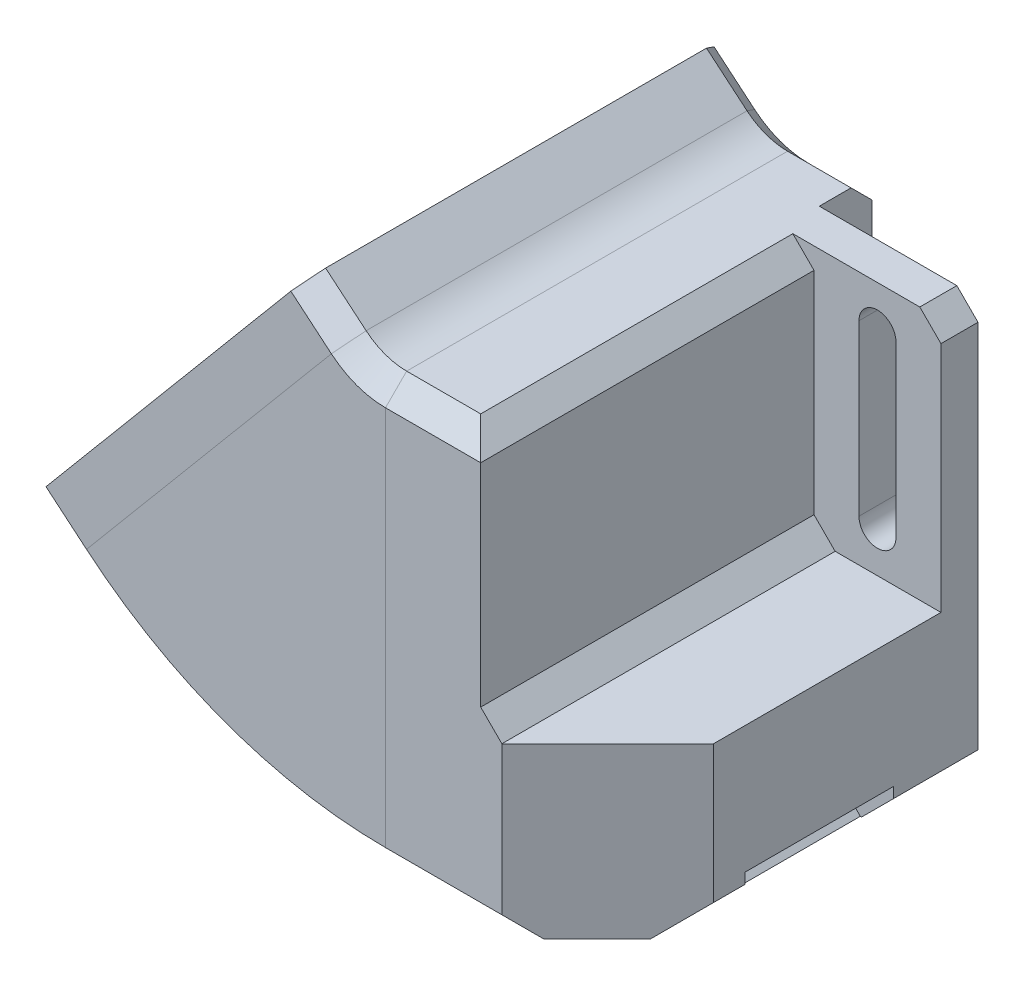
from build123d import *

# Parameters (mm, degrees)
SKETCH3_W                = 40
SKETCH3_H                = 40
SKETCH3_W_2              = 34
SKETCH3_H_2              = 34
BOSS_EXTRUDE2_REACH      = 64.147
SKETCH7_W                = 16
SKETCH7_H                = 28
BOSS_EXTRUDE5_DEPTH      = 1
BOSS_EXTRUDE5_DEPTH_BACK = 5
SKETCH8_W                = 13
SKETCH8_H                = 40
CHAMFER1_SIZE            = 6
CHAMFER2_SIZE            = 4
SKETCH9_W                = 14
SKETCH9_H                = 3
CUT_EXTRUDE1_DEPTH       = 16
SKETCH10_W               = 12
SKETCH10_H               = 24
CUT_EXTRUDE2_DEPTH       = 72.149717806
SKETCH11_W               = 15
SKETCH11_H               = 40
BOSS_EXTRUDE6_DEPTH      = 7
CUT_EXTRUDE3_DEPTH       = 66.163504693
CUT_EXTRUDE4_REACH       = 60.927
SKETCH13_W               = 12
SKETCH13_H               = 3.5
SKETCH15_W               = 4.5
SKETCH15_H               = 4.5
BOSS_EXTRUDE7_DEPTH      = 5
SKETCH14_R               = 1.5
CUT_EXTRUDE5_DEPTH       = 8
CHAMFER3_SIZE            = 14
CHAMFER7_SIZE            = 3
CHAMFER4_SIZE            = 14
CHAMFER5_SIZE            = 2
CHAMFER9_SIZE            = 2
CHAMFER10_SIZE           = 2.121320344
CHAMFER10_SIZE_2         = 1.5
CHAMFER11_SIZE           = 10
CHAMFER12_SIZE           = 2


# Some blends are built 0.0001 mm under size
with BuildPart() as part:
    # Sweep1: sweep along a path in Sketch2
    with BuildLine(Plane.XY) as sweep1_path:
        Line((0, 0), (-5, 0))
        ThreePointArc((-5, 0), (-20.718824406, 2.771652848), (-34.541726603, 10.752309152))
        Line((-34.541726603, 10.752309152), (-38.371948819, 13.966247201))
    # Sketch3 → Sweep1 (sweep)
    with BuildSketch(Plane(origin=(0, 0, 0), x_dir=(0, 0, -1), z_dir=(1, 0, 0))):
        with Locations((0, 20)):
            Rectangle(SKETCH3_W, SKETCH3_H)
        with Locations((0, 20)):
            Rectangle(SKETCH3_W_2, SKETCH3_H_2, mode=Mode.SUBTRACT)
    sweep(path=sweep1_path.line)

    # Boss-Extrude2: up to this face of the body (flat: up to its plane)
    boss_extrude2_end = Plane(part.part.faces().sort_by_distance((-2.5, 40, 0))[0])
    # Sketch7 → Boss-Extrude2 (add, up to the picked face)
    with BuildSketch(Plane(origin=(0, 0, 0), x_dir=(1, 0, 0), z_dir=(0, 1, 0)), mode=Mode.PRIVATE) as boss_extrude2_sk1:
        with Locations((8, -6)):
            Rectangle(SKETCH7_W, SKETCH7_H)
    boss_extrude2_tool1 = split(extrude(boss_extrude2_sk1.sketch, amount=BOSS_EXTRUDE2_REACH, mode=Mode.PRIVATE), bisect_by=boss_extrude2_end, keep=Keep.BOTH, mode=Mode.PRIVATE)
    add(boss_extrude2_tool1.solids().sort_by(Axis((8, 0, 6), (0, 1, 0)))[0])

    # Sketch8 → Boss-Extrude5 (add, two sides: drawn at the far end of the back side and taken through both)
    with BuildSketch(Plane(origin=(0, 0, 0), x_dir=(0, 0, -1), z_dir=(1, 0, 0)).offset(-BOSS_EXTRUDE5_DEPTH_BACK)):
        with Locations((13.5, 20)):
            Rectangle(SKETCH8_W, SKETCH8_H)
    extrude(amount=BOSS_EXTRUDE5_DEPTH + BOSS_EXTRUDE5_DEPTH_BACK)

    # Chamfer1
    chamfer1_edges = [part.edges().sort_by_distance(p)[0] for p in [
        (-5, 20, -17),
    ]]
    chamfer(chamfer1_edges, length=CHAMFER1_SIZE)

    # Chamfer2
    chamfer2_edges = [part.edges().sort_by_distance(p)[0] for p in [
        (-5, 20, -7),
    ]]
    chamfer(chamfer2_edges, length=CHAMFER2_SIZE - 0.0001)  # a hair under: the kernel refuses the full size

    # Sketch9 → Cut-Extrude1 (cut)
    with BuildSketch(Plane(origin=(16, 0, 0), x_dir=(0, 0, -1), z_dir=(1, 0, 0))):
        with Locations((0, 2.5)):
            Rectangle(SKETCH9_W, SKETCH9_H)
    extrude(amount=-CUT_EXTRUDE1_DEPTH, mode=Mode.SUBTRACT)

    # Sketch10 → Cut-Extrude2 (cut, through all)
    with BuildSketch(Plane.XY.offset(20)):
        with Locations((10, 28)):
            Rectangle(SKETCH10_W, SKETCH10_H)
    extrude(amount=-CUT_EXTRUDE2_DEPTH, mode=Mode.SUBTRACT)

    # Sketch11 → Boss-Extrude6 (add)
    with BuildSketch(Plane(origin=(0, 0, -8), x_dir=(-1, 0, 0), z_dir=(0, 0, -1))):
        with Locations((-8.5, 20)):
            Rectangle(SKETCH11_W, SKETCH11_H)
    extrude(amount=BOSS_EXTRUDE6_DEPTH)

    # Sketch12 → Cut-Extrude3 (cut, through all)
    with BuildSketch(Plane.XY.offset(-8)):
        with BuildLine():
            Line((11.75, 36), (11.75, 20))
            ThreePointArc((11.75, 20), (10, 18.25), (8.25, 20))
            Line((8.25, 20), (8.25, 36))
            ThreePointArc((8.25, 36), (10, 37.75), (11.75, 36))
        make_face()
    extrude(amount=-CUT_EXTRUDE3_DEPTH, mode=Mode.SUBTRACT)

    # Cut-Extrude4: up to this face of the body (flat: up to its plane)
    cut_extrude4_end = Plane(part.part.faces().sort_by_distance((10, 16, 6))[0])
    # Sketch13 → Cut-Extrude4 (cut, up to the picked face)
    with BuildSketch(Plane(origin=(0, 40, 0), x_dir=(1, 0, 0), z_dir=(0, 1, 0)), mode=Mode.PRIVATE) as cut_extrude4_sk1:
        with Locations((10, 9.75)):
            Rectangle(SKETCH13_W, SKETCH13_H)
    cut_extrude4_tool1 = split(extrude(cut_extrude4_sk1.sketch, amount=-CUT_EXTRUDE4_REACH, mode=Mode.PRIVATE), bisect_by=cut_extrude4_end, keep=Keep.BOTH, mode=Mode.PRIVATE)
    add(cut_extrude4_tool1.solids().sort_by(Axis((10, 40, -9.75), (0, -1, 0)))[0], mode=Mode.SUBTRACT)

    # Sketch15 → Boss-Extrude7 (add)
    with BuildSketch(Plane(origin=(-29.394618164, 24.66501326, 0), x_dir=(0, 0, 1), z_dir=(-0.7660444431189811, 0.6427876096865356, 0))):
        with Locations((-14.75, 20.783752799)):
            Rectangle(SKETCH15_W, SKETCH15_H)
        with Locations((14.75, 20.783752799)):
            Rectangle(SKETCH15_W, SKETCH15_H)
        with Locations((-14.75, -8.716247201)):
            Rectangle(SKETCH15_W, SKETCH15_H)
        with Locations((14.75, -8.716247201)):
            Rectangle(SKETCH15_W, SKETCH15_H)
    extrude(amount=-BOSS_EXTRUDE7_DEPTH)

    # Sketch14 → Cut-Extrude5 (cut)
    with BuildSketch(Plane(origin=(-29.394618164, 24.66501326, 0), x_dir=(0, 0, 1), z_dir=(-0.7660444431189811, 0.6427876096865356, 0))):
        with Locations(Location((-16, 22.033752799, 0), (0, 0, 270))):
            Circle(SKETCH14_R)
        with Locations(Location((16, 22.033752799, 0), (0, 0, 270))):
            Circle(SKETCH14_R)
        with Locations(Location((-16, -9.966247201, 0), (0, 0, 270))):
            Circle(SKETCH14_R)
        with Locations(Location((16, -9.966247201, 0), (0, 0, 270))):
            Circle(SKETCH14_R)
    extrude(amount=-CUT_EXTRUDE5_DEPTH, mode=Mode.SUBTRACT)

    # Chamfer3
    chamfer3_edges = [part.edges().sort_by_distance(p)[0] for p in [
        (0, 4, 0),
    ]]
    chamfer(chamfer3_edges, length=CHAMFER3_SIZE)

    # Chamfer7
    # the kernel refuses this chamfer: 3 mm, written as the material it takes off along each edge
    with BuildSketch(Plane(origin=(16, 0, 27.715048964), x_dir=(0.027495876610586778, 0.9996219169112968, 0), z_dir=(0, 0, -1))) as chamfer7_piece_1:
        Polygon((CHAMFER7_SIZE * 0.999621916911, -CHAMFER7_SIZE * 0.0274958766106), (-CHAMFER7_SIZE * 0.0274958766106, -CHAMFER7_SIZE * 0.999621916911), (0, 0), align=None)
    extrude(amount=50.430097928, mode=Mode.SUBTRACT)

    # Chamfer4
    # the kernel refuses this chamfer: 14 mm, written as the material it takes off along each edge
    with BuildSketch(Plane(origin=(0, 54.003561832, 7), x_dir=(-0.027495876610586376, 0, 0.9996219169112968), z_dir=(0, -1, 0))) as chamfer4_piece_1_section:
        Polygon((CHAMFER4_SIZE * 0.999621916911, -CHAMFER4_SIZE * 0.0274958766106), (-CHAMFER4_SIZE * 0.0274958766106, -CHAMFER4_SIZE * 0.999621916911), (0, 0), align=None)
    chamfer4_piece_1 = extrude(amount=51.003561832, mode=Mode.PRIVATE)
    chamfer4_piece_1 = split(chamfer4_piece_1, bisect_by=Plane(origin=(0.666666667, 16.666666667, 17), z_dir=(0, 0, -1)), keep=Keep.TOP, mode=Mode.PRIVATE)
    chamfer4_piece_1 = split(chamfer4_piece_1, bisect_by=Plane(origin=(1, 17, 12), z_dir=(-0.7071067811865476, -0.7071067811865476, 0)), keep=Keep.TOP, mode=Mode.PRIVATE)
    add(chamfer4_piece_1, mode=Mode.SUBTRACT)

    # Chamfer5
    chamfer5_edges = [part.edges().sort_by_distance(p)[0] for p in [
        (0, 3, 0),
    ]]
    chamfer(chamfer5_edges, length=CHAMFER5_SIZE - 0.0001)  # a hair under: the kernel refuses the full size

    # Chamfer9
    chamfer9_edges = [part.edges().sort_by_distance(p)[0] for p in [
        (4, 16, 4.25),
        (4, 40, 4.25),
        (16, 40, -13.25),
    ]]
    chamfer(chamfer9_edges, length=CHAMFER9_SIZE)

    # Chamfer10
    # the kernel refuses this chamfer: 2.121320344, 1.5 mm, written as the material it takes off along each edge
    with BuildSketch(Plane(origin=(14, 1, -7), x_dir=(-0.9996219169112964, 0.02749587661059746, 0), z_dir=(0, 0, 1))) as chamfer10_piece_1:
        Polygon((CHAMFER10_SIZE * 0.999621916703, CHAMFER10_SIZE * 0.0274958766049), (CHAMFER10_SIZE_2 * 0.687396915265, CHAMFER10_SIZE_2 * 0.726281956876), (0, 0), align=None)
    extrude(amount=14, mode=Mode.SUBTRACT)

    # Chamfer11
    chamfer11_edges = [part.edges().sort_by_distance(p)[0] for p in [
        (16, 9.5, 20),
    ]]
    chamfer(chamfer11_edges, length=CHAMFER11_SIZE)

    # Chamfer12
    chamfer12_edges = [part.edges().sort_by_distance(p)[0] for p in [
        (-10.745333323, 43.001055901, -20),
        (-7.038018673, 40.359357679, -20),
        (-2, 40, -20),
        (-36.456837711, 12.359278177, -20),
        (-20.718824406, 2.771652848, -20),
        (-2, 0, -20),
        (-36.456837711, 12.359278177, 20),
        (-20.718824406, 2.771652848, 20),
        (0.5, 0, 20),
        (-10.745333323, 43.001055901, 20),
        (-7.038018673, 40.359357679, 20),
        (-1.5, 40, 20),
        (-31.635930638, 18.1046115, 12.5),
        (-15.566240396, 37.255722578, 12.5),
        (-15.566240396, 37.255722578, -12.5),
        (-31.635930638, 18.1046115, -12.5),
    ]]
    chamfer(chamfer12_edges, length=CHAMFER12_SIZE)


solid = part.part
